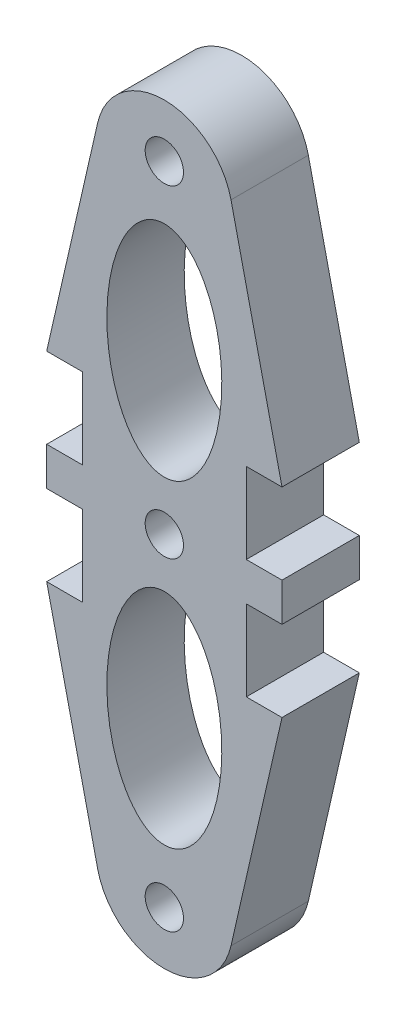
from build123d import *

# Parameters (mm, degrees)
SKETCH1_R           = 1.45
BOSS_EXTRUDE1_DEPTH = 5.85


with BuildPart() as part:
    # Sketch1 → Boss-Extrude1 (new body)
    with BuildSketch(Plane.XY):
        with BuildLine():
            Line((781.459168709, 470.952359197), (781.459168709, 464.852359197))
            Line((781.459168709, 464.852359197), (778.759168709, 464.852359197))
            Line((778.759168709, 464.852359197), (778.759168709, 461.952359197))
            Line((778.759168709, 461.952359197), (781.459168709, 461.952359197))
            Line((781.459168709, 461.952359197), (781.459168709, 455.852359197))
            Line((781.459168709, 455.852359197), (778.759168709, 455.852359197))
            Line((778.759168709, 455.852359197), (782.615047744, 438.967359197))
            ThreePointArc((782.615047744, 438.967359197), (787.659168709, 434.945268649), (792.703289673, 438.967359197))
            Line((792.703289673, 438.967359197), (796.559168709, 455.852359197))
            Line((796.559168709, 455.852359197), (793.859168709, 455.852359197))
            Line((793.859168709, 455.852359197), (793.859168709, 461.952359197))
            Line((793.859168709, 461.952359197), (796.559168709, 461.952359197))
            Line((796.559168709, 461.952359197), (796.559168709, 464.852359197))
            Line((796.559168709, 464.852359197), (793.859168709, 464.852359197))
            Line((793.859168709, 464.852359197), (793.859168709, 470.952359197))
            Line((793.859168709, 470.952359197), (796.559168709, 470.952359197))
            Line((796.559168709, 470.952359197), (792.703289673, 487.837359197))
            ThreePointArc((792.703289673, 487.837359197), (787.659168709, 491.859449744), (782.615047744, 487.837359197))
            Line((782.615047744, 487.837359197), (778.759168709, 470.952359197))
            Line((778.759168709, 470.952359197), (781.459168709, 470.952359197))
        make_face()
        with Locations((787.659168709, 438.967359197)):
            Circle(SKETCH1_R, mode=Mode.SUBTRACT)
        with BuildLine():
            add(Edge.make_bspline(
                [(787.659168709, 443.054519601), (795.187523069, 443.054519601), (791.423345889, 455.507640433), (787.659168709, 467.960761265), (783.894991529, 455.507640433), (780.130814348, 443.054519601), (787.659168709, 443.054519601)],
                knots=[0, 0, 0, 2.094395102, 2.094395102, 4.188790205, 4.188790205, 6.283185307, 6.283185307, 6.283185307], degree=2, weights=[1, 0.5, 1, 0.5, 1, 0.5, 1]))
        make_face(mode=Mode.SUBTRACT)
        with Locations((787.659168709, 463.402359197)):
            Circle(SKETCH1_R, mode=Mode.SUBTRACT)
        with BuildLine():
            add(Edge.make_bspline(
                [(787.659168709, 483.750198792), (780.130814348, 483.750198792), (783.894991529, 471.29707796), (787.659168709, 458.843957128), (791.423345889, 471.29707796), (795.187523069, 483.750198792), (787.659168709, 483.750198792)],
                knots=[0, 0, 0, 2.094395102, 2.094395102, 4.188790205, 4.188790205, 6.283185307, 6.283185307, 6.283185307], degree=2, weights=[1, 0.5, 1, 0.5, 1, 0.5, 1]))
        make_face(mode=Mode.SUBTRACT)
        with Locations((787.659168709, 487.837359197)):
            Circle(SKETCH1_R, mode=Mode.SUBTRACT)
    extrude(amount=BOSS_EXTRUDE1_DEPTH)


solid = part.part
